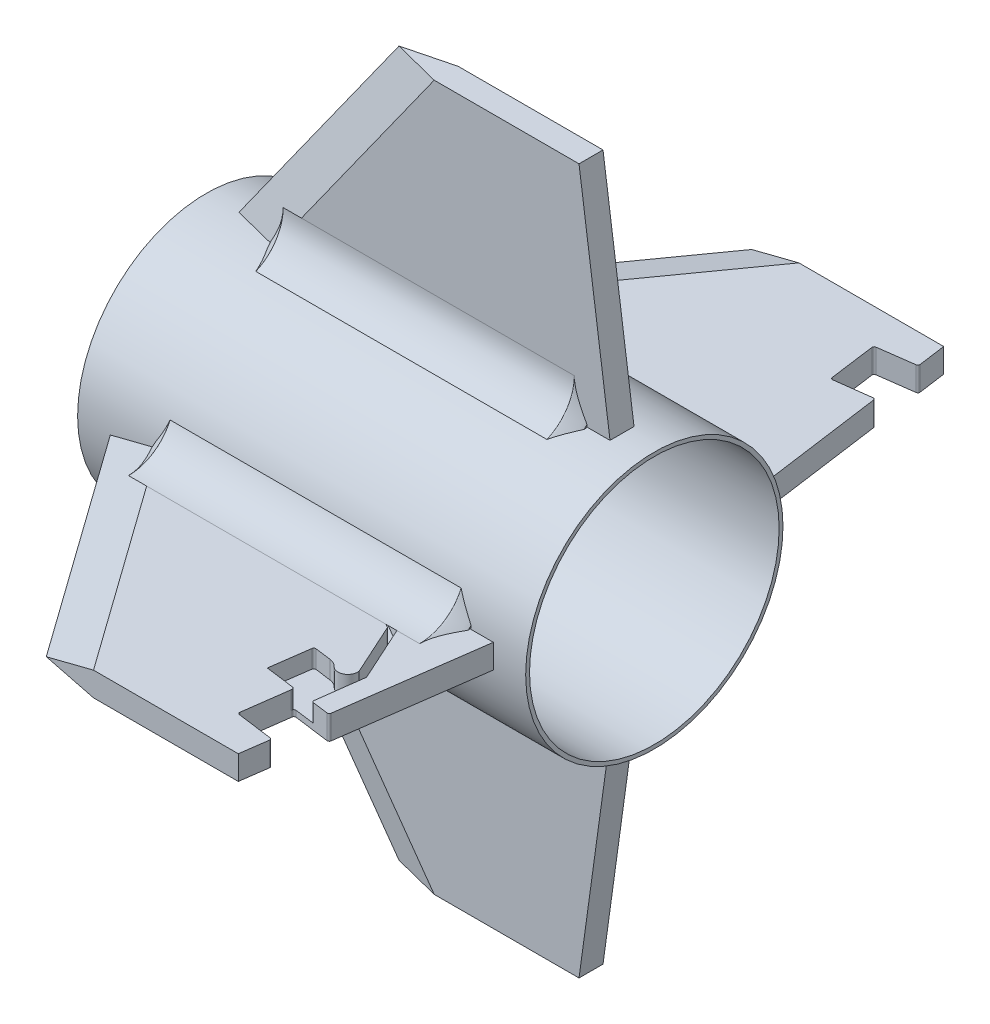
from build123d import *

# Parameters (mm, degrees)
BOSS_EXTRUDE1_DEPTH         = 9.525
CUT_EXTRUDE11_DEPTH         = 109.249530891
CUT_EXTRUDE12_DEPTH         = 109.249530891
CUT_EXTRUDE1_DEPTH          = 164.459241155
FILLET25_R                  = 0.79375
CUT_EXTRUDE8_DEPTH          = 7.112
FILLET31_R                  = 0.79375
BOSS_EXTRUDE7_DEPTH         = 120.626
BOSS_EXTRUDE7_DEPTH_BACK    = 57.174
SKETCH20_R                  = 51.054
CIRPATTERN6_COUNT           = 2
BOSS_EXTRUDE11_DEPTH        = 4.7625
BOSS_EXTRUDE11_DEPTH_BACK   = 4.7625
BOSS_EXTRUDE11_2_DEPTH      = 4.7625
BOSS_EXTRUDE11_2_DEPTH_BACK = 4.7625
CUT_EXTRUDE14_DEPTH         = 109.249530891
CUT_EXTRUDE15_DEPTH         = 109.249530891
SKETCH24_R                  = 49.53
CUT_EXTRUDE16_DEPTH         = 177.8
BOSS_EXTRUDE13_DEPTH        = 3
BOSS_EXTRUDE13_DEPTH_BACK   = 122.5
BOSS_EXTRUDE13_START        = -25
BOSS_EXTRUDE13_2_DEPTH      = 3
BOSS_EXTRUDE13_2_DEPTH_BACK = 122.5
BOSS_EXTRUDE13_2_START      = -25
FILLET17_SIZE               = 5
FILLET18_SIZE               = 5
CIRPATTERN9_COUNT           = 4


with BuildPart() as part:
    # Sketch2 → Boss-Extrude1 (new body)
    with BuildSketch(Plane(origin=(0, 0, 0), x_dir=(1, 0, 0), z_dir=(0, 1, 0))):
        Polygon((95.501036211, 33.603610094), (107.801036211, 122.503610094), (-44.198963789, 122.503610094), (19.301036211, 33.603610094), align=None)
    extrude(amount=BOSS_EXTRUDE1_DEPTH)

    # Sketch40 → Cut-Extrude11 (cut, along a direction that is not the sketch's normal)
    with BuildSketch(Plane(origin=(0, 0, -122.503610094), x_dir=(-1, 0, 0), z_dir=(0, 0, -1))):
        Polygon((44.198963789, 4.7625), (25.464097027, 0), (44.198963789, 0), align=None)
    extrude(amount=-CUT_EXTRUDE11_DEPTH, dir=(-0.5812381937190961, 0, -0.8137334712067352), mode=Mode.SUBTRACT)

    # Sketch41 → Cut-Extrude12 (cut, along a direction that is not the sketch's normal)
    with BuildSketch(Plane(origin=(0, 0, -122.503610094), x_dir=(-1, 0, 0), z_dir=(0, 0, -1))):
        Polygon((44.198963789, 4.7625), (44.198963789, 9.525), (25.464097027, 9.525), align=None)
    extrude(amount=-CUT_EXTRUDE12_DEPTH, dir=(-0.5812381937190961, 0, -0.8137334712067352), mode=Mode.SUBTRACT)

    # Sketch3 → Cut-Extrude1 (cut, through all)
    with BuildSketch(Plane(origin=(0, 9.525, 0), x_dir=(1, 0, 0), z_dir=(0, 1, 0))):
        Polygon((97.113715989, 45.259482639), (81.457758718, 47.377913426), (84.139549011, 67.197297897), (99.863827857, 65.136307442), align=None)
    extrude(amount=-CUT_EXTRUDE1_DEPTH, mode=Mode.SUBTRACT)

    # Fillet25
    fillet25_edges = [part.edges().sort_by_distance(p)[0] for p in [
        (99.863827857, 4.7625, -65.136307442),
        (97.113715989, 4.7625, -45.259482639),
        (81.457758718, 4.7625, -47.377913426),
        (84.139549011, 4.7625, -67.197297897),
    ]]
    fillet(fillet25_edges, radius=FILLET25_R)

    # Sketch4 → Cut-Extrude8 (cut)
    with BuildSketch(Plane(origin=(0, 9.525, 0), x_dir=(1, 0, 0), z_dir=(0, 1, 0))):
        with BuildLine():
            Line((93.956000122, 80.007694019), (94.626625576, 85.129310246))
            ThreePointArc((94.626625576, 85.129310246), (94.624623336, 85.351200342), (94.561709184, 85.563993747))
            Line((94.561709184, 85.563993747), (84.166615365, 108.42930289))
            ThreePointArc((84.166615365, 108.42930289), (84.03233056, 108.634104903), (83.842381483, 108.788686989))
            Line((83.842381483, 108.788686989), (60.49737734, 122.44927454))
            ThreePointArc((60.49737734, 122.44927454), (60.40077402, 122.489785422), (60.296936592, 122.503610094))
            Line((60.296936592, 122.503610094), (54.464486911, 122.503610094))
            Line((54.464486911, 122.503610094), (58.889378955, 119.91433554))
            Line((58.889378955, 119.91433554), (81.505428428, 106.680303883))
            ThreePointArc((81.505428428, 106.680303883), (81.695377504, 106.525721796), (81.82966231, 106.320919784))
            Line((81.82966231, 106.320919784), (91.05711574, 86.023981731))
            ThreePointArc((91.05711574, 86.023981731), (89.403562167, 82.123240214), (85.167931899, 82.025977477))
            ThreePointArc((85.167931899, 82.025977477), (84.640764026, 82.50367193), (84.106050666, 82.972904901))
            ThreePointArc((84.106050666, 82.972904901), (82.811231696, 83.819271869), (81.324728088, 84.247290827))
            Line((81.324728088, 84.247290827), (74.046769317, 85.20663167))
            Line((74.046769317, 85.20663167), (73.187354806, 78.98382312))
            Line((73.187354806, 78.98382312), (71.783222706, 68.816848836))
            Line((71.783222706, 68.816848836), (84.134706976, 67.197932545))
            Line((84.134706976, 67.197932545), (83.982403289, 66.035935097))
            Line((83.982403289, 66.035935097), (85.092006513, 65.891015289))
            Line((85.092006513, 65.891015289), (84.883355399, 64.293442449))
            Line((84.883355399, 64.293442449), (88.812923978, 63.780220865))
            Line((88.812923978, 63.780220865), (89.173045737, 66.537554528))
            Line((89.173045737, 66.537554528), (92.141275387, 66.148506926))
            Line((92.141275387, 66.148506926), (93.956000122, 80.007694019))
        make_face()
        with BuildLine():
            Line((84.498578608, -92.347727009), (84.746715146, -92.378194345))
            Line((84.746715146, -92.378194345), (83.040544339, -106.273840468))
            Line((83.040544339, -106.273840468), (80.062905884, -105.908232438))
            Line((80.062905884, -105.908232438), (79.726807251, -108.645536137))
            Line((79.726807251, -108.645536137), (75.749643234, -108.1572018))
            Line((75.749643234, -108.1572018), (76.085741867, -105.4198981))
            Line((76.085741867, -105.4198981), (62.693332196, -103.775649516))
            Line((62.693332196, -103.775649516), (64.716379331, -87.299252811))
            Line((64.716379331, -87.299252811), (72.002575296, -88.193885183))
            ThreePointArc((72.002575296, -88.193885183), (73.492823515, -88.608678446), (74.795112026, -89.443506478))
            ThreePointArc((74.795112026, -89.443506478), (75.333973793, -89.907969559), (75.865365559, -90.380960837))
            ThreePointArc((75.865365559, -90.380960837), (77.16765407, -91.215788868), (78.657902289, -91.630582132))
            Line((78.657902289, -91.630582132), (84.498578608, -92.347727009))
        make_face()
    extrude(amount=-CUT_EXTRUDE8_DEPTH, mode=Mode.SUBTRACT)

    # Fillet31
    fillet31_edges = [part.edges().sort_by_distance(p)[0] for p in [
        (92.141275387, 5.969, -66.148506926),
        (84.134706976, 5.969, -67.197932545),
        (74.046769317, 5.969, -85.20663167),
        (54.464486911, 5.969, -122.503610094),
    ]]
    fillet(fillet31_edges, radius=FILLET31_R)


with BuildPart() as body_2:
    # Sketch20 → Boss-Extrude7 (new, two sides: drawn at the far end of the back side and taken through both)
    with BuildSketch(Plane(origin=(0, 0, 0), x_dir=(0, 0, -1), z_dir=(1, 0, 0)).offset(-BOSS_EXTRUDE7_DEPTH_BACK)):
        with Locations((173.557610094, 4.7625)):
            Circle(SKETCH20_R)
    extrude(amount=BOSS_EXTRUDE7_DEPTH + BOSS_EXTRUDE7_DEPTH_BACK)

    # Sketch24 → Cut-Extrude16 (cut)
    with BuildSketch(Plane(origin=(120.626, 0, 0), x_dir=(0, 0, -1), z_dir=(1, 0, 0))):
        with Locations((173.557610094, 4.7625)):
            Circle(SKETCH24_R)
    extrude(amount=-CUT_EXTRUDE16_DEPTH, mode=Mode.SUBTRACT)


with BuildPart() as cirpattern6_1:
    # CirPattern6: pattern copy
    add(part.part.rotate(Axis((0, 4.7625, -173.557610094), (1, 0, 0)), 1 * 360 / CIRPATTERN6_COUNT))


with BuildPart() as body_4:
    # Sketch35 → Boss-Extrude11 (new, two sides: drawn at the far end of the back side and taken through both)
    with BuildSketch(Plane(origin=(0, 0, -173.557610094), x_dir=(-1, 0, 0), z_dir=(0, 0, -1)).offset(-BOSS_EXTRUDE11_DEPTH_BACK)):
        Polygon((44.198963789, -46.2375), (-107.801036211, -46.2375), (-95.501036211, -135.1375), (-19.301036211, -135.1375), align=None)
    extrude(amount=BOSS_EXTRUDE11_DEPTH + BOSS_EXTRUDE11_DEPTH_BACK)

    # Sketch43 → Cut-Extrude14 (cut, along a direction that is not the sketch's normal)
    with BuildSketch(Plane(origin=(0, -46.2375, 0), x_dir=(1, 0, 0), z_dir=(0, 1, 0))):
        Polygon((-25.464096989, 168.795110094), (-44.198963789, 173.557610094), (-44.198963789, 168.795110094), align=None)
        Polygon((-44.198963789, 178.320110094), (-44.198963789, 173.557610094), (-25.464096989, 178.320110094), align=None)
    extrude(amount=-CUT_EXTRUDE14_DEPTH, dir=(-0.5812381937190956, 0.8137334712067356, 0), mode=Mode.SUBTRACT)


with BuildPart() as body_5:
    # Sketch35 → Boss-Extrude11 2 (new, two sides: drawn at the far end of the back side and taken through both)
    with BuildSketch(Plane(origin=(0, 0, -173.557610094), x_dir=(-1, 0, 0), z_dir=(0, 0, -1)).offset(-BOSS_EXTRUDE11_2_DEPTH_BACK)):
        Polygon((-95.501036211, 144.6625), (-107.801036211, 55.7625), (44.198963789, 55.7625), (-19.301036211, 144.6625), align=None)
    extrude(amount=BOSS_EXTRUDE11_2_DEPTH + BOSS_EXTRUDE11_2_DEPTH_BACK)

    # Sketch44 → Cut-Extrude15 (cut, along a direction that is not the sketch's normal)
    with BuildSketch(Plane.XZ.offset(-55.7625)):
        Polygon((-44.198963789, -168.795110094), (-44.198963789, -173.557610094), (-25.464096989, -168.795110094), align=None)
        Polygon((-25.464096989, -178.320110094), (-44.198963789, -173.557610094), (-44.198963789, -178.320110094), align=None)
    extrude(amount=-CUT_EXTRUDE15_DEPTH, dir=(-0.5812381937190975, -0.8137334712067342, 0), mode=Mode.SUBTRACT)


with BuildPart() as body_6:
    # Sketch47 → Boss-Extrude13 (new, two sides: drawn at the far end of the back side and taken through both)
    with BuildSketch(Plane(origin=(120.626, 0, 0), x_dir=(0, 0, -1), z_dir=(1, 0, 0)).offset(BOSS_EXTRUDE13_START - BOSS_EXTRUDE13_DEPTH_BACK)):
        with BuildLine():
            Line((178.320110094, 55.593883119), (189.192336548, 54.426723526))
            ThreePointArc((189.192336548, 54.426723526), (181.282665252, 61.043638561), (178.320110094, 70.921377752))
            Line((178.320110094, 70.921377752), (178.320110094, 55.593883119))
        make_face()
    extrude(amount=BOSS_EXTRUDE13_DEPTH + BOSS_EXTRUDE13_DEPTH_BACK)

    # Fillet17
    # a fillet whose section is not a circle: 5 mm, written as the material it takes off along each edge
    with BuildSketch(Plane(origin=(98.626, 70.921377752, -196.268546311), x_dir=(0, -0.7116480637636262, -0.7025361437972296), z_dir=(0, 0.7025361437972296, -0.7116480637636262))) as fillet17_piece_1:
        with BuildLine():
            Bezier((17.948436217, FILLET17_SIZE), (17.948436217, 0), (17.948436217 + FILLET17_SIZE, 0), weights=[1, 0.037216146, 1])
            Line((17.948436217 + FILLET17_SIZE, 0), (17.948436217, 0))
            Line((17.948436217, 0), (17.948436217, FILLET17_SIZE))
        make_face()
    revolve(axis=Axis((98.626, 70.921377752, -196.268546311), (-1, 0, 0)), revolution_arc=174.542703455, mode=Mode.SUBTRACT)
    with BuildSketch(Plane(origin=(-26.874, 70.921377752, -196.268546311), x_dir=(0, -0.7116480637636262, -0.7025361437972296), z_dir=(0, 0.7025361437972296, -0.7116480637636262))) as fillet17_piece_2:
        with BuildLine():
            Bezier((17.948436217 + FILLET17_SIZE, 0), (17.948436217, 0), (17.948436217, -FILLET17_SIZE), weights=[1, 0.037216146, 1])
            Line((17.948436217, -FILLET17_SIZE), (17.948436217, 0))
            Line((17.948436217, 0), (17.948436217 + FILLET17_SIZE, 0))
        make_face()
    revolve(axis=Axis((-26.874, 70.921377752, -196.268546311), (-1, 0, 0)), revolution_arc=174.542703455, mode=Mode.SUBTRACT)


with BuildPart() as body_7:
    # Sketch47 → Boss-Extrude13 2 (new, two sides: drawn at the far end of the back side and taken through both)
    with BuildSketch(Plane(origin=(120.626, 0, 0), x_dir=(0, 0, -1), z_dir=(1, 0, 0)).offset(BOSS_EXTRUDE13_2_START - BOSS_EXTRUDE13_2_DEPTH_BACK)):
        with BuildLine():
            Line((168.795110094, 55.593883119), (157.922883639, 54.426723526))
            ThreePointArc((157.922883639, 54.426723526), (165.832554935, 61.043638561), (168.795110094, 70.921377752))
            Line((168.795110094, 70.921377752), (168.795110094, 55.593883119))
        make_face()
    extrude(amount=BOSS_EXTRUDE13_2_DEPTH + BOSS_EXTRUDE13_2_DEPTH_BACK)

    # Fillet18
    # a fillet whose section is not a circle: 5 mm, written as the material it takes off along each edge
    with BuildSketch(Plane(origin=(-26.874, 70.921377752, -150.846673876), x_dir=(0, -0.7116480637636223, 0.7025361437972337), z_dir=(0, 0.7025361437972337, 0.7116480637636223))) as fillet18_piece_1:
        with BuildLine():
            Bezier((17.948436217 + FILLET18_SIZE, 0), (17.948436217, 0), (17.948436217, FILLET18_SIZE), weights=[1, 0.037216146, 1])
            Line((17.948436217, FILLET18_SIZE), (17.948436217, 0))
            Line((17.948436217, 0), (17.948436217 + FILLET18_SIZE, 0))
        make_face()
    revolve(axis=Axis((-26.874, 70.921377752, -150.846673876), (1, 0, 0)), revolution_arc=174.542703455, mode=Mode.SUBTRACT)
    with BuildSketch(Plane(origin=(98.626, 70.921377752, -150.846673876), x_dir=(0, -0.7116480637636223, 0.7025361437972337), z_dir=(0, 0.7025361437972337, 0.7116480637636223))) as fillet18_piece_2:
        with BuildLine():
            Bezier((17.948436217, -FILLET18_SIZE), (17.948436217, 0), (17.948436217 + FILLET18_SIZE, 0), weights=[1, 0.037216146, 1])
            Line((17.948436217 + FILLET18_SIZE, 0), (17.948436217, 0))
            Line((17.948436217, 0), (17.948436217, -FILLET18_SIZE))
        make_face()
    revolve(axis=Axis((98.626, 70.921377752, -150.846673876), (1, 0, 0)), revolution_arc=174.542703455, mode=Mode.SUBTRACT)


with BuildPart() as cirpattern9_1:
    # CirPattern9: pattern copy
    add(body_7.part.rotate(Axis((120.626, 4.7625, -173.557610094), (1, 0, 0)), 1 * 360 / CIRPATTERN9_COUNT))


with BuildPart() as cirpattern9_2:
    # CirPattern9: pattern copy
    add(body_7.part.rotate(Axis((120.626, 4.7625, -173.557610094), (1, 0, 0)), 2 * 360 / CIRPATTERN9_COUNT))


with BuildPart() as cirpattern9_3:
    # CirPattern9: pattern copy
    add(body_7.part.rotate(Axis((120.626, 4.7625, -173.557610094), (1, 0, 0)), 3 * 360 / CIRPATTERN9_COUNT))


with BuildPart() as cirpattern9_4:
    # CirPattern9: pattern copy
    add(body_6.part.rotate(Axis((120.626, 4.7625, -173.557610094), (1, 0, 0)), 1 * 360 / CIRPATTERN9_COUNT))


with BuildPart() as cirpattern9_5:
    # CirPattern9: pattern copy
    add(body_6.part.rotate(Axis((120.626, 4.7625, -173.557610094), (1, 0, 0)), 2 * 360 / CIRPATTERN9_COUNT))


with BuildPart() as cirpattern9_6:
    # CirPattern9: pattern copy
    add(body_6.part.rotate(Axis((120.626, 4.7625, -173.557610094), (1, 0, 0)), 3 * 360 / CIRPATTERN9_COUNT))


solid = Compound([part.part, body_2.part, cirpattern6_1.part, body_4.part, body_5.part, body_6.part, body_7.part, cirpattern9_1.part, cirpattern9_2.part, cirpattern9_3.part, cirpattern9_4.part, cirpattern9_5.part, cirpattern9_6.part])
